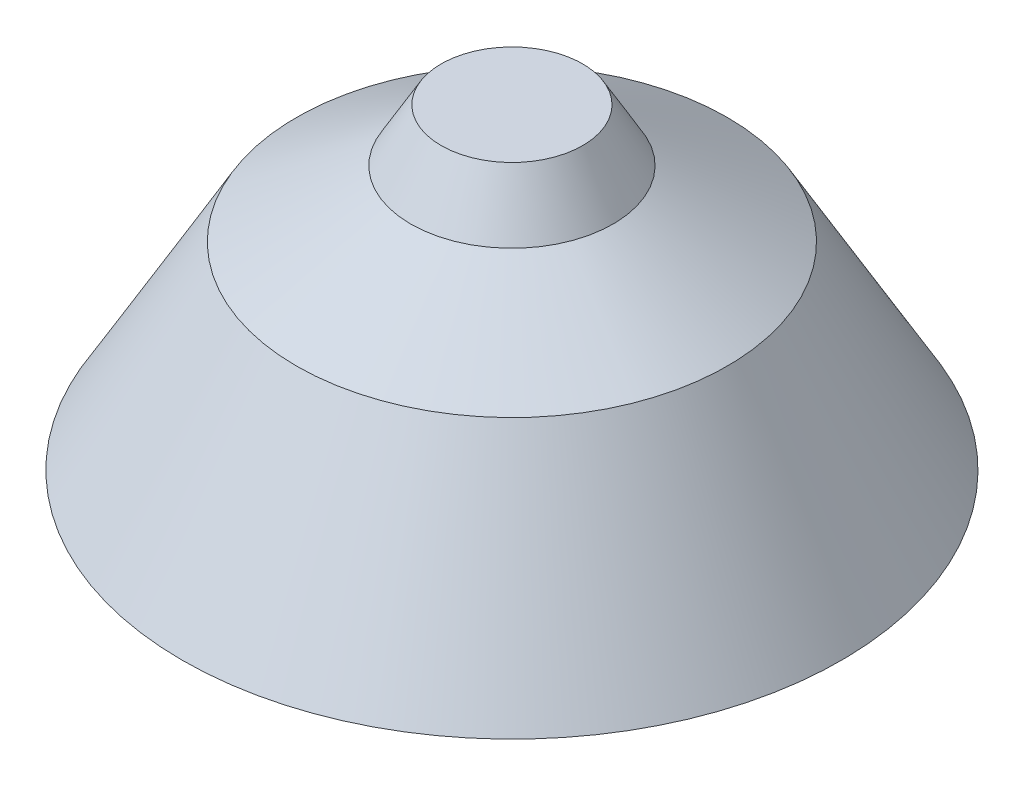
from build123d import *

# Parameters (mm, degrees)
SKETCH3_R              = 2500
BACKSHELL_DEPTH        = 1500
CHAMFER1_SIZE2         = 866.025403784
CHAMFER1_SIZE          = 1500
SKETCH7_R              = 1633.974596216
TOP_OF_BACKSHELL_DEPTH = 500
CHAMFER2_SIZE2         = 866.025403784
CHAMFER2_SIZE          = 500
SKETCH9_R              = 767.949192431
HATCH_DEPTH            = 400
CHAMFER3_SIZE2         = 230.940107676
CHAMFER3_SIZE          = 400


# Read off the part's stored shape, not the designer's step: Shell1
with BuildPart() as part:
    # Sketch3 → Backshell (new body)
    with BuildSketch(Plane(origin=(0, 0, 0), x_dir=(1, 0, 0), z_dir=(0, 1, 0))):
        with Locations(Location((0, 286.368581012, 0), (0, 0, 270))):
            Circle(SKETCH3_R)
    extrude(amount=BACKSHELL_DEPTH)

    # Chamfer1
    chamfer1_edges = [part.edges().sort_by_distance(p)[0] for p in [
        (0, 1500, -2786.368581012),
    ]]
    chamfer1_side = [part.faces().sort_by_distance(p)[0] for p in [
        (0, 1482.679491924, -2786.368581012),
    ]]
    chamfer(chamfer1_edges, length=CHAMFER1_SIZE - 0.0001, length2=CHAMFER1_SIZE2 - 0.0001, reference=chamfer1_side[0])  # a hair under: the kernel refuses the full size

    # Sketch7 → Top of Backshell (add)
    with BuildSketch(Plane(origin=(0, 1500, 0), x_dir=(1, 0, 0), z_dir=(0, 1, 0))):
        with Locations(Location((0, 286.368581012, 0), (0, 0, 270))):
            Circle(SKETCH7_R)
    extrude(amount=TOP_OF_BACKSHELL_DEPTH)

    # Chamfer2
    chamfer2_edges = [part.edges().sort_by_distance(p)[0] for p in [
        (0, 2000, -1920.343177228),
    ]]
    chamfer2_side = [part.faces().sort_by_distance(p)[0] for p in [
        (0, 1990, -1920.343177228),
    ]]
    chamfer(chamfer2_edges, length=CHAMFER2_SIZE - 0.0001, length2=CHAMFER2_SIZE2 - 0.0001, reference=chamfer2_side[0])  # a hair under: the kernel refuses the full size

    # Sketch9 → Hatch (add)
    with BuildSketch(Plane(origin=(0, 2000, 0), x_dir=(1, 0, 0), z_dir=(0, 1, 0))):
        with Locations(Location((0, 286.368581012, 0), (0, 0, 270))):
            Circle(SKETCH9_R)
    extrude(amount=HATCH_DEPTH)

    # Chamfer3
    chamfer3_edges = [part.edges().sort_by_distance(p)[0] for p in [
        (0, 2400, -1054.317773444),
    ]]
    chamfer3_side = [part.faces().sort_by_distance(p)[0] for p in [
        (0, 2395.381197846, -1054.317773444),
    ]]
    chamfer(chamfer3_edges, length=CHAMFER3_SIZE - 0.0001, length2=CHAMFER3_SIZE2 - 0.0001, reference=chamfer3_side[0])  # a hair under: the kernel refuses the full size

    # Shell1 outline → Shell1 (revolve, cut)
    with BuildSketch(Plane.XY.offset(-286.368581012)):
        Polygon((2442.264973081, 0), (1597.372055837, 1463.397459622), (731.346652053, 1963.397459622), (508.141571296, 2350), (0, 2350), (0, 0), align=None)
    revolve(axis=Axis((0, 0, -286.368581012), (0, 1, 0)), mode=Mode.SUBTRACT)


solid = part.part
